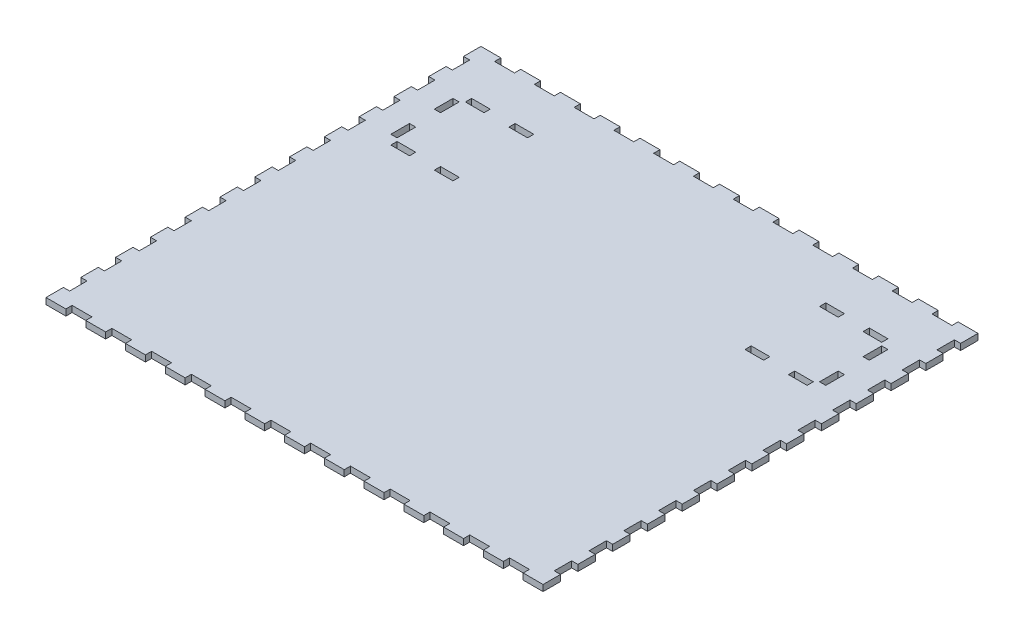
from build123d import *

# Parameters (mm, degrees)
ESQUISSE1_W                = 400
ESQUISSE1_H                = 350
BOSS_EXTRU_1_DEPTH         = 5
ESQUISSE2_W                = 16
ESQUISSE2_H                = 5
ENL_V_MAT_EXTRU_1_DEPTH    = 5
R_P_TITION_LIN_AIRE1_COUNT = 12
R_P_TITION_LIN_AIRE1_PITCH = 32
ESQUISSE3_W                = 5
ESQUISSE3_H                = 14
ENL_V_MAT_EXTRU_2_DEPTH    = 5
R_P_TITION_LIN_AIRE2_COUNT = 12
R_P_TITION_LIN_AIRE2_PITCH = 28
SYM_TRIE1_COPY_1_SKETCH_W  = 16
SYM_TRIE1_COPY_1_SKETCH_H  = 5
SYM_TRIE1_COPY_1_DEPTH     = 5
SYM_TRIE1_COPY_2_SKETCH_W  = 16
SYM_TRIE1_COPY_2_SKETCH_H  = 5
SYM_TRIE1_COPY_2_DEPTH     = 5
SYM_TRIE1_COPY_3_SKETCH_W  = 16
SYM_TRIE1_COPY_3_SKETCH_H  = 5
SYM_TRIE1_COPY_3_DEPTH     = 5
SYM_TRIE1_COPY_4_SKETCH_W  = 16
SYM_TRIE1_COPY_4_SKETCH_H  = 5
SYM_TRIE1_COPY_4_DEPTH     = 5
SYM_TRIE1_COPY_5_SKETCH_W  = 16
SYM_TRIE1_COPY_5_SKETCH_H  = 5
SYM_TRIE1_COPY_5_DEPTH     = 5
SYM_TRIE1_COPY_6_SKETCH_W  = 16
SYM_TRIE1_COPY_6_SKETCH_H  = 5
SYM_TRIE1_COPY_6_DEPTH     = 5
SYM_TRIE1_COPY_7_SKETCH_W  = 16
SYM_TRIE1_COPY_7_SKETCH_H  = 5
SYM_TRIE1_COPY_7_DEPTH     = 5
SYM_TRIE1_COPY_8_SKETCH_W  = 16
SYM_TRIE1_COPY_8_SKETCH_H  = 5
SYM_TRIE1_COPY_8_DEPTH     = 5
SYM_TRIE1_COPY_9_SKETCH_W  = 16
SYM_TRIE1_COPY_9_SKETCH_H  = 5
SYM_TRIE1_COPY_9_DEPTH     = 5
SYM_TRIE1_COPY_10_SKETCH_W = 16
SYM_TRIE1_COPY_10_SKETCH_H = 5
SYM_TRIE1_COPY_10_DEPTH    = 5
SYM_TRIE1_COPY_11_SKETCH_W = 16
SYM_TRIE1_COPY_11_SKETCH_H = 5
SYM_TRIE1_COPY_11_DEPTH    = 5
SYM_TRIE1_COPY_12_SKETCH_W = 16
SYM_TRIE1_COPY_12_SKETCH_H = 5
SYM_TRIE1_COPY_12_DEPTH    = 5
SYM_TRIE2_COPY_1_SKETCH_W  = 5
SYM_TRIE2_COPY_1_SKETCH_H  = 14
SYM_TRIE2_COPY_1_DEPTH     = 5
SYM_TRIE2_COPY_2_SKETCH_W  = 5
SYM_TRIE2_COPY_2_SKETCH_H  = 14
SYM_TRIE2_COPY_2_DEPTH     = 5
SYM_TRIE2_COPY_3_SKETCH_W  = 5
SYM_TRIE2_COPY_3_SKETCH_H  = 14
SYM_TRIE2_COPY_3_DEPTH     = 5
SYM_TRIE2_COPY_4_SKETCH_W  = 5
SYM_TRIE2_COPY_4_SKETCH_H  = 14
SYM_TRIE2_COPY_4_DEPTH     = 5
SYM_TRIE2_COPY_5_SKETCH_W  = 5
SYM_TRIE2_COPY_5_SKETCH_H  = 14
SYM_TRIE2_COPY_5_DEPTH     = 5
SYM_TRIE2_COPY_6_SKETCH_W  = 5
SYM_TRIE2_COPY_6_SKETCH_H  = 14
SYM_TRIE2_COPY_6_DEPTH     = 5
SYM_TRIE2_COPY_7_SKETCH_W  = 5
SYM_TRIE2_COPY_7_SKETCH_H  = 14
SYM_TRIE2_COPY_7_DEPTH     = 5
SYM_TRIE2_COPY_8_SKETCH_W  = 5
SYM_TRIE2_COPY_8_SKETCH_H  = 14
SYM_TRIE2_COPY_8_DEPTH     = 5
SYM_TRIE2_COPY_9_SKETCH_W  = 5
SYM_TRIE2_COPY_9_SKETCH_H  = 14
SYM_TRIE2_COPY_9_DEPTH     = 5
SYM_TRIE2_COPY_10_SKETCH_W = 5
SYM_TRIE2_COPY_10_SKETCH_H = 14
SYM_TRIE2_COPY_10_DEPTH    = 5
SYM_TRIE2_COPY_11_SKETCH_W = 5
SYM_TRIE2_COPY_11_SKETCH_H = 14
SYM_TRIE2_COPY_11_DEPTH    = 5
SYM_TRIE2_COPY_12_SKETCH_W = 5
SYM_TRIE2_COPY_12_SKETCH_H = 14
SYM_TRIE2_COPY_12_DEPTH    = 5
ESQUISSE4_W                = 15
ESQUISSE4_H                = 5
ESQUISSE4_W_2              = 5
ESQUISSE4_H_2              = 15
ENL_V_MAT_EXTRU_3_DEPTH    = 5


with BuildPart() as part:
    # Esquisse1 → Boss.-Extru.1 (new body)
    with BuildSketch(Plane(origin=(0, 0, 0), x_dir=(1, 0, 0), z_dir=(0, 1, 0))):
        with Locations((200, -175)):
            Rectangle(ESQUISSE1_W, ESQUISSE1_H)
    extrude(amount=BOSS_EXTRU_1_DEPTH)

    # Esquisse2 → Enlèv. mat.-Extru.1 (cut)
    with BuildSketch(Plane(origin=(0, 5, 0), x_dir=(1, 0, 0), z_dir=(0, 1, 0))):
        with Locations((24, -2.5)):
            Rectangle(ESQUISSE2_W, ESQUISSE2_H)
    enl_v_mat_extru_1 = extrude(amount=-ENL_V_MAT_EXTRU_1_DEPTH, mode=Mode.SUBTRACT)

    # Répétition linéaire1: Enlèv. mat.-Extru.1 ×12
    with Locations(*[(i * R_P_TITION_LIN_AIRE1_PITCH, 0, 0) for i in range(1, R_P_TITION_LIN_AIRE1_COUNT)]):
        add(enl_v_mat_extru_1, mode=Mode.SUBTRACT)

    # Esquisse3 → Enlèv. mat.-Extru.2 (cut)
    with BuildSketch(Plane(origin=(0, 5, 0), x_dir=(1, 0, 0), z_dir=(0, 1, 0))):
        with Locations((2.5, -21)):
            Rectangle(ESQUISSE3_W, ESQUISSE3_H)
    enl_v_mat_extru_2 = extrude(amount=-ENL_V_MAT_EXTRU_2_DEPTH, mode=Mode.SUBTRACT)

    # Répétition linéaire2: Enlèv. mat.-Extru.2 ×12
    with Locations(*[(0, 0, i * R_P_TITION_LIN_AIRE2_PITCH) for i in range(1, R_P_TITION_LIN_AIRE2_COUNT)]):
        add(enl_v_mat_extru_2, mode=Mode.SUBTRACT)

    # Symétrie1 copy 1 sketch → Symétrie1 copy 1 (cut)
    with BuildSketch(Plane(origin=(32, 5, 350), x_dir=(1, 0, 0), z_dir=(0, 1, 0))):
        with Locations((24, 2.5)):
            Rectangle(SYM_TRIE1_COPY_1_SKETCH_W, SYM_TRIE1_COPY_1_SKETCH_H)
    extrude(amount=-SYM_TRIE1_COPY_1_DEPTH, mode=Mode.SUBTRACT)

    # Symétrie1 copy 2 sketch → Symétrie1 copy 2 (cut)
    with BuildSketch(Plane(origin=(64, 5, 350), x_dir=(1, 0, 0), z_dir=(0, 1, 0))):
        with Locations((24, 2.5)):
            Rectangle(SYM_TRIE1_COPY_2_SKETCH_W, SYM_TRIE1_COPY_2_SKETCH_H)
    extrude(amount=-SYM_TRIE1_COPY_2_DEPTH, mode=Mode.SUBTRACT)

    # Symétrie1 copy 3 sketch → Symétrie1 copy 3 (cut)
    with BuildSketch(Plane(origin=(96, 5, 350), x_dir=(1, 0, 0), z_dir=(0, 1, 0))):
        with Locations((24, 2.5)):
            Rectangle(SYM_TRIE1_COPY_3_SKETCH_W, SYM_TRIE1_COPY_3_SKETCH_H)
    extrude(amount=-SYM_TRIE1_COPY_3_DEPTH, mode=Mode.SUBTRACT)

    # Symétrie1 copy 4 sketch → Symétrie1 copy 4 (cut)
    with BuildSketch(Plane(origin=(128, 5, 350), x_dir=(1, 0, 0), z_dir=(0, 1, 0))):
        with Locations((24, 2.5)):
            Rectangle(SYM_TRIE1_COPY_4_SKETCH_W, SYM_TRIE1_COPY_4_SKETCH_H)
    extrude(amount=-SYM_TRIE1_COPY_4_DEPTH, mode=Mode.SUBTRACT)

    # Symétrie1 copy 5 sketch → Symétrie1 copy 5 (cut)
    with BuildSketch(Plane(origin=(160, 5, 350), x_dir=(1, 0, 0), z_dir=(0, 1, 0))):
        with Locations((24, 2.5)):
            Rectangle(SYM_TRIE1_COPY_5_SKETCH_W, SYM_TRIE1_COPY_5_SKETCH_H)
    extrude(amount=-SYM_TRIE1_COPY_5_DEPTH, mode=Mode.SUBTRACT)

    # Symétrie1 copy 6 sketch → Symétrie1 copy 6 (cut)
    with BuildSketch(Plane(origin=(192, 5, 350), x_dir=(1, 0, 0), z_dir=(0, 1, 0))):
        with Locations((24, 2.5)):
            Rectangle(SYM_TRIE1_COPY_6_SKETCH_W, SYM_TRIE1_COPY_6_SKETCH_H)
    extrude(amount=-SYM_TRIE1_COPY_6_DEPTH, mode=Mode.SUBTRACT)

    # Symétrie1 copy 7 sketch → Symétrie1 copy 7 (cut)
    with BuildSketch(Plane(origin=(224, 5, 350), x_dir=(1, 0, 0), z_dir=(0, 1, 0))):
        with Locations((24, 2.5)):
            Rectangle(SYM_TRIE1_COPY_7_SKETCH_W, SYM_TRIE1_COPY_7_SKETCH_H)
    extrude(amount=-SYM_TRIE1_COPY_7_DEPTH, mode=Mode.SUBTRACT)

    # Symétrie1 copy 8 sketch → Symétrie1 copy 8 (cut)
    with BuildSketch(Plane(origin=(256, 5, 350), x_dir=(1, 0, 0), z_dir=(0, 1, 0))):
        with Locations((24, 2.5)):
            Rectangle(SYM_TRIE1_COPY_8_SKETCH_W, SYM_TRIE1_COPY_8_SKETCH_H)
    extrude(amount=-SYM_TRIE1_COPY_8_DEPTH, mode=Mode.SUBTRACT)

    # Symétrie1 copy 9 sketch → Symétrie1 copy 9 (cut)
    with BuildSketch(Plane(origin=(288, 5, 350), x_dir=(1, 0, 0), z_dir=(0, 1, 0))):
        with Locations((24, 2.5)):
            Rectangle(SYM_TRIE1_COPY_9_SKETCH_W, SYM_TRIE1_COPY_9_SKETCH_H)
    extrude(amount=-SYM_TRIE1_COPY_9_DEPTH, mode=Mode.SUBTRACT)

    # Symétrie1 copy 10 sketch → Symétrie1 copy 10 (cut)
    with BuildSketch(Plane(origin=(320, 5, 350), x_dir=(1, 0, 0), z_dir=(0, 1, 0))):
        with Locations((24, 2.5)):
            Rectangle(SYM_TRIE1_COPY_10_SKETCH_W, SYM_TRIE1_COPY_10_SKETCH_H)
    extrude(amount=-SYM_TRIE1_COPY_10_DEPTH, mode=Mode.SUBTRACT)

    # Symétrie1 copy 11 sketch → Symétrie1 copy 11 (cut)
    with BuildSketch(Plane(origin=(352, 5, 350), x_dir=(1, 0, 0), z_dir=(0, 1, 0))):
        with Locations((24, 2.5)):
            Rectangle(SYM_TRIE1_COPY_11_SKETCH_W, SYM_TRIE1_COPY_11_SKETCH_H)
    extrude(amount=-SYM_TRIE1_COPY_11_DEPTH, mode=Mode.SUBTRACT)

    # Symétrie1 copy 12 sketch → Symétrie1 copy 12 (cut)
    with BuildSketch(Plane(origin=(0, 5, 350), x_dir=(1, 0, 0), z_dir=(0, 1, 0))):
        with Locations((24, 2.5)):
            Rectangle(SYM_TRIE1_COPY_12_SKETCH_W, SYM_TRIE1_COPY_12_SKETCH_H)
    extrude(amount=-SYM_TRIE1_COPY_12_DEPTH, mode=Mode.SUBTRACT)

    # Symétrie2 copy 1 sketch → Symétrie2 copy 1 (cut)
    with BuildSketch(Plane(origin=(400, 5, 28), x_dir=(-1, 0, 0), z_dir=(0, 1, 0))):
        with Locations((2.5, 21)):
            Rectangle(SYM_TRIE2_COPY_1_SKETCH_W, SYM_TRIE2_COPY_1_SKETCH_H)
    extrude(amount=-SYM_TRIE2_COPY_1_DEPTH, mode=Mode.SUBTRACT)

    # Symétrie2 copy 2 sketch → Symétrie2 copy 2 (cut)
    with BuildSketch(Plane(origin=(400, 5, 56), x_dir=(-1, 0, 0), z_dir=(0, 1, 0))):
        with Locations((2.5, 21)):
            Rectangle(SYM_TRIE2_COPY_2_SKETCH_W, SYM_TRIE2_COPY_2_SKETCH_H)
    extrude(amount=-SYM_TRIE2_COPY_2_DEPTH, mode=Mode.SUBTRACT)

    # Symétrie2 copy 3 sketch → Symétrie2 copy 3 (cut)
    with BuildSketch(Plane(origin=(400, 5, 84), x_dir=(-1, 0, 0), z_dir=(0, 1, 0))):
        with Locations((2.5, 21)):
            Rectangle(SYM_TRIE2_COPY_3_SKETCH_W, SYM_TRIE2_COPY_3_SKETCH_H)
    extrude(amount=-SYM_TRIE2_COPY_3_DEPTH, mode=Mode.SUBTRACT)

    # Symétrie2 copy 4 sketch → Symétrie2 copy 4 (cut)
    with BuildSketch(Plane(origin=(400, 5, 112), x_dir=(-1, 0, 0), z_dir=(0, 1, 0))):
        with Locations((2.5, 21)):
            Rectangle(SYM_TRIE2_COPY_4_SKETCH_W, SYM_TRIE2_COPY_4_SKETCH_H)
    extrude(amount=-SYM_TRIE2_COPY_4_DEPTH, mode=Mode.SUBTRACT)

    # Symétrie2 copy 5 sketch → Symétrie2 copy 5 (cut)
    with BuildSketch(Plane(origin=(400, 5, 140), x_dir=(-1, 0, 0), z_dir=(0, 1, 0))):
        with Locations((2.5, 21)):
            Rectangle(SYM_TRIE2_COPY_5_SKETCH_W, SYM_TRIE2_COPY_5_SKETCH_H)
    extrude(amount=-SYM_TRIE2_COPY_5_DEPTH, mode=Mode.SUBTRACT)

    # Symétrie2 copy 6 sketch → Symétrie2 copy 6 (cut)
    with BuildSketch(Plane(origin=(400, 5, 168), x_dir=(-1, 0, 0), z_dir=(0, 1, 0))):
        with Locations((2.5, 21)):
            Rectangle(SYM_TRIE2_COPY_6_SKETCH_W, SYM_TRIE2_COPY_6_SKETCH_H)
    extrude(amount=-SYM_TRIE2_COPY_6_DEPTH, mode=Mode.SUBTRACT)

    # Symétrie2 copy 7 sketch → Symétrie2 copy 7 (cut)
    with BuildSketch(Plane(origin=(400, 5, 196), x_dir=(-1, 0, 0), z_dir=(0, 1, 0))):
        with Locations((2.5, 21)):
            Rectangle(SYM_TRIE2_COPY_7_SKETCH_W, SYM_TRIE2_COPY_7_SKETCH_H)
    extrude(amount=-SYM_TRIE2_COPY_7_DEPTH, mode=Mode.SUBTRACT)

    # Symétrie2 copy 8 sketch → Symétrie2 copy 8 (cut)
    with BuildSketch(Plane(origin=(400, 5, 224), x_dir=(-1, 0, 0), z_dir=(0, 1, 0))):
        with Locations((2.5, 21)):
            Rectangle(SYM_TRIE2_COPY_8_SKETCH_W, SYM_TRIE2_COPY_8_SKETCH_H)
    extrude(amount=-SYM_TRIE2_COPY_8_DEPTH, mode=Mode.SUBTRACT)

    # Symétrie2 copy 9 sketch → Symétrie2 copy 9 (cut)
    with BuildSketch(Plane(origin=(400, 5, 252), x_dir=(-1, 0, 0), z_dir=(0, 1, 0))):
        with Locations((2.5, 21)):
            Rectangle(SYM_TRIE2_COPY_9_SKETCH_W, SYM_TRIE2_COPY_9_SKETCH_H)
    extrude(amount=-SYM_TRIE2_COPY_9_DEPTH, mode=Mode.SUBTRACT)

    # Symétrie2 copy 10 sketch → Symétrie2 copy 10 (cut)
    with BuildSketch(Plane(origin=(400, 5, 280), x_dir=(-1, 0, 0), z_dir=(0, 1, 0))):
        with Locations((2.5, 21)):
            Rectangle(SYM_TRIE2_COPY_10_SKETCH_W, SYM_TRIE2_COPY_10_SKETCH_H)
    extrude(amount=-SYM_TRIE2_COPY_10_DEPTH, mode=Mode.SUBTRACT)

    # Symétrie2 copy 11 sketch → Symétrie2 copy 11 (cut)
    with BuildSketch(Plane(origin=(400, 5, 308), x_dir=(-1, 0, 0), z_dir=(0, 1, 0))):
        with Locations((2.5, 21)):
            Rectangle(SYM_TRIE2_COPY_11_SKETCH_W, SYM_TRIE2_COPY_11_SKETCH_H)
    extrude(amount=-SYM_TRIE2_COPY_11_DEPTH, mode=Mode.SUBTRACT)

    # Symétrie2 copy 12 sketch → Symétrie2 copy 12 (cut)
    with BuildSketch(Plane(origin=(400, 5, 0), x_dir=(-1, 0, 0), z_dir=(0, 1, 0))):
        with Locations((2.5, 21)):
            Rectangle(SYM_TRIE2_COPY_12_SKETCH_W, SYM_TRIE2_COPY_12_SKETCH_H)
    extrude(amount=-SYM_TRIE2_COPY_12_DEPTH, mode=Mode.SUBTRACT)

    # Esquisse4 → Enlèv. mat.-Extru.3 (cut)
    with BuildSketch(Plane(origin=(0, 5, 0), x_dir=(1, 0, 0), z_dir=(0, 1, 0))):
        with Locations((40, -42.5)):
            Rectangle(ESQUISSE4_W, ESQUISSE4_H)
        with Locations((75, -42.5)):
            Rectangle(ESQUISSE4_W, ESQUISSE4_H)
        with Locations((40, -102.5)):
            Rectangle(ESQUISSE4_W, ESQUISSE4_H)
        with Locations((75, -102.5)):
            Rectangle(ESQUISSE4_W, ESQUISSE4_H)
        with Locations((27.5, -55)):
            Rectangle(ESQUISSE4_W_2, ESQUISSE4_H_2)
        with Locations((27.5, -90)):
            Rectangle(ESQUISSE4_W_2, ESQUISSE4_H_2)
    enl_v_mat_extru_3 = extrude(amount=-ENL_V_MAT_EXTRU_3_DEPTH, mode=Mode.SUBTRACT)

    # Symétrie3: Enlèv. mat.-Extru.3 across plane
    add(enl_v_mat_extru_3.mirror(Plane(origin=(200, 0, 0), x_dir=(0, 0, 1), z_dir=(1, 0, 0))), mode=Mode.SUBTRACT)


solid = part.part
